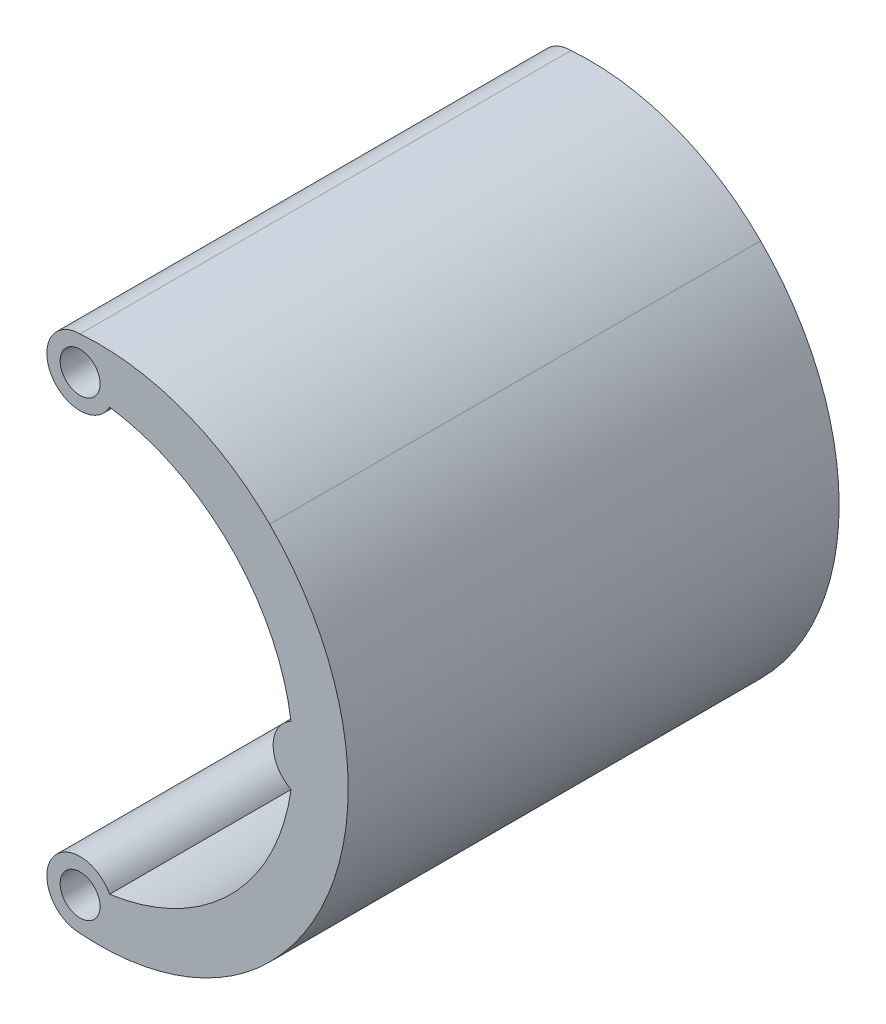
from build123d import *

# Parameters (mm, degrees)
BOSS_EXTRUDE1_DEPTH             = 36.881
F_3_0MM_DOWEL_HOLE1_D           = 3
F_3_0MM_DOWEL_HOLE1_CSINK_D     = 3.05
F_3_0MM_DOWEL_HOLE1_CSINK_ANGLE = 100
SKETCH7_R                       = 1.715
CUT_EXTRUDE2_DEPTH              = 5


with BuildPart() as part:
    # Sketch1 → Boss-Extrude1 (new body)
    with BuildSketch(Plane(origin=(0, 0, 0), x_dir=(0, 1, 0), z_dir=(0, 0, 1))):
        with BuildLine():
            ThreePointArc((2.217506139, -15.845588235), (0, -14.5), (-2.217506139, -15.845588235))
            ThreePointArc((-2.217506139, -15.845588235), (-11.313708499, -11.313708499), (-15.845588235, -2.217506139))
            ThreePointArc((-15.845588235, -2.217506139), (-15.703086243, 2.137291441), (-19.5, 0))
            ThreePointArc((-19.5, 0), (-18.432354788, -7.697408632), (-14.241833588, -14.241833588))
            ThreePointArc((-14.241833588, -14.241833588), (0, -20.140994214), (14.241833588, -14.241833588))
            ThreePointArc((14.241833588, -14.241833588), (18.432354788, -7.697408632), (19.5, 0))
            ThreePointArc((19.5, 0), (15.703086243, 2.137291441), (15.845588235, -2.217506139))
            ThreePointArc((15.845588235, -2.217506139), (11.313708499, -11.313708499), (2.217506139, -15.845588235))
        make_face()
    extrude(amount=BOSS_EXTRUDE1_DEPTH)

    # Ø3.0mm Dowel Hole1 (through all)
    with Locations(Plane(origin=(0, 0, 0), x_dir=(1, 0, 0), z_dir=(0, 0, -1))):
        with Locations((0, -17), (0, 17)):
            CounterSinkHole(F_3_0MM_DOWEL_HOLE1_D / 2, F_3_0MM_DOWEL_HOLE1_CSINK_D / 2, counter_sink_angle=F_3_0MM_DOWEL_HOLE1_CSINK_ANGLE)

    # Sketch7 → Cut-Extrude2 (cut)
    with BuildSketch(Plane(origin=(0, 0, 0), x_dir=(1, 0, 0), z_dir=(0, 0, -1))):
        with Locations((-17, 0)):
            Circle(SKETCH7_R)
        with Locations((17, 0)):
            Circle(SKETCH7_R)
    extrude(amount=-CUT_EXTRUDE2_DEPTH, mode=Mode.SUBTRACT)


solid = part.part
